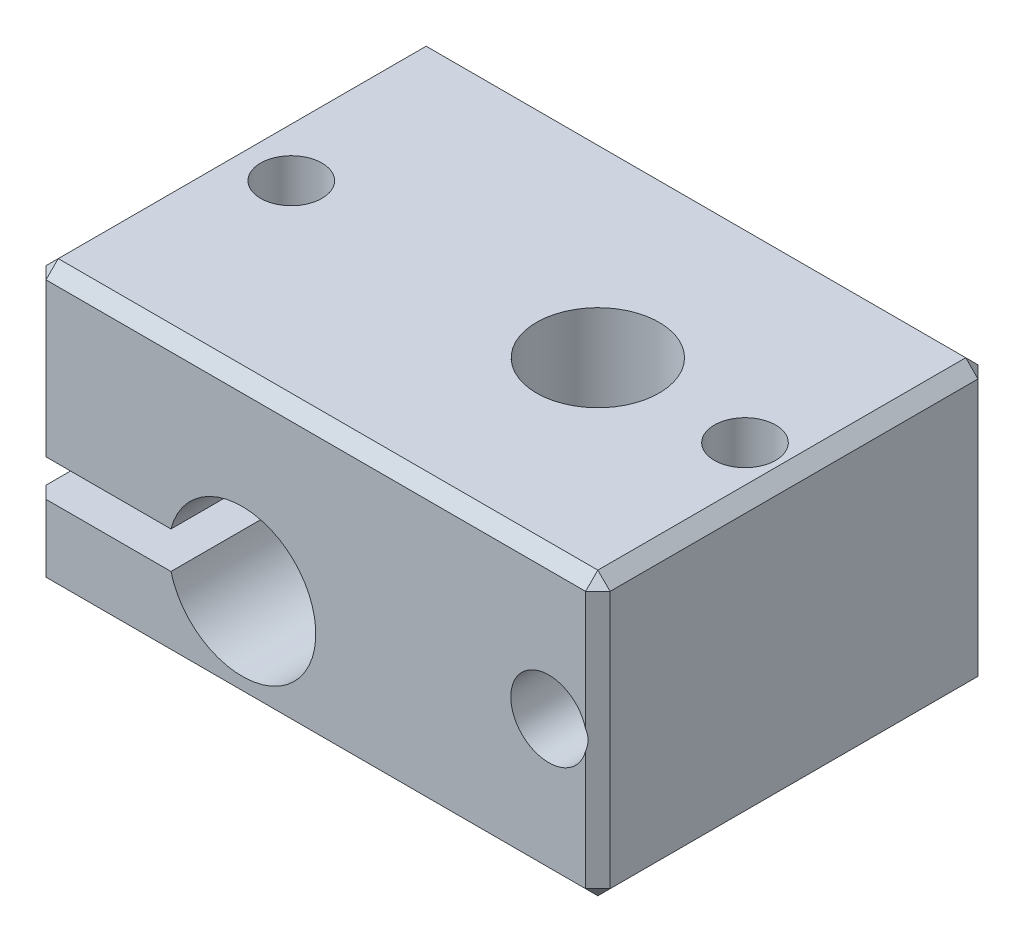
from build123d import *

# Parameters (mm, degrees)
SKETCH1_W                  = 23
SKETCH1_H                  = 16
BOSS_EXTRUDE1_DEPTH        = 11.5
SKETCH10_R                 = 1.55
CUT_EXTRUDE2_DEPTH         = 31.286135442
M3X0_5_TAPPED_HOLE1_REACH  = 32.286
M3X0_5_TAPPED_HOLE1_BORE_R = 1.25
M6_TAPPED_HOLE1_D          = 5
CUT_EXTRUDE1_DEPTH         = 16


with BuildPart() as part:
    # Sketch1 → Boss-Extrude1 (new body)
    with BuildSketch(Plane(origin=(0, 0, 0), x_dir=(1, 0, 0), z_dir=(0, 1, 0))):
        with Locations((11.5, 8)):
            Rectangle(SKETCH1_W, SKETCH1_H)
    extrude(amount=BOSS_EXTRUDE1_DEPTH)

    # Sketch10 → Cut-Extrude2 (cut, through all)
    with BuildSketch(Plane.XY):
        with Locations((21, 5.75)):
            Circle(SKETCH10_R)
    extrude(amount=-CUT_EXTRUDE2_DEPTH, mode=Mode.SUBTRACT)

    # M3x0.5 Tapped Hole1 bore → M3x0.5 Tapped Hole1 (cut, up to next)
    with BuildSketch(Plane(origin=(0, 11.5, 0), x_dir=(1, 0, 0), z_dir=(0, 1, 0)), mode=Mode.PRIVATE) as m3x0_5_tapped_hole1_sk1:
        with Locations((2.5, 8)):
            Circle(M3X0_5_TAPPED_HOLE1_BORE_R)
    m3x0_5_tapped_hole1_tool1 = extrude(m3x0_5_tapped_hole1_sk1.sketch, amount=-M3X0_5_TAPPED_HOLE1_REACH, mode=Mode.PRIVATE) & part.part
    # M3x0.5 Tapped Hole1 bore → M3x0.5 Tapped Hole1 (cut, up to next)
    with BuildSketch(Plane(origin=(0, 11.5, 0), x_dir=(1, 0, 0), z_dir=(0, 1, 0)), mode=Mode.PRIVATE) as m3x0_5_tapped_hole1_sk2:
        with Locations((21, 8)):
            Circle(M3X0_5_TAPPED_HOLE1_BORE_R)
    m3x0_5_tapped_hole1_tool2 = extrude(m3x0_5_tapped_hole1_sk2.sketch, amount=-M3X0_5_TAPPED_HOLE1_REACH, mode=Mode.PRIVATE) & part.part
    add(m3x0_5_tapped_hole1_tool1.solids().sort_by_distance((2.5, 11.5, -8))[0], mode=Mode.SUBTRACT)
    add(m3x0_5_tapped_hole1_tool2.solids().sort_by_distance((21, 11.5, -8))[0], mode=Mode.SUBTRACT)

    # M6 Tapped Hole1 (through all)
    with Locations(Plane(origin=(0, 11.5, 0), x_dir=(1, 0, 0), z_dir=(0, 1, 0))):
        with Locations((15, 8)):
            Hole(M6_TAPPED_HOLE1_D / 2)

    # Sketch2 → Cut-Extrude1 (cut)
    with BuildSketch(Plane.XY):
        with BuildLine():
            Line((5.59526249, 4.75), (0, 4.75))
            Line((0, 4.75), (0, 3.25))
            Line((0, 3.25), (5.59526249, 3.25))
            ThreePointArc((5.59526249, 3.25), (5.5, 4), (5.59526249, 4.75))
        make_face()
        with BuildLine():
            ThreePointArc((11.5, 4), (8.878012877, 6.976089089), (5.59526249, 4.75))
            Line((5.59526249, 4.75), (5.59526249, 3.25))
            ThreePointArc((5.59526249, 3.25), (8.878012877, 1.023910911), (11.5, 4))
        make_face()
        with BuildLine():
            Line((5.59526249, 3.25), (5.59526249, 4.75))
            ThreePointArc((5.59526249, 4.75), (5.5, 4), (5.59526249, 3.25))
        make_face()
    extrude(amount=-CUT_EXTRUDE1_DEPTH, mode=Mode.SUBTRACT)

    # Chamfer1
    # the kernel refuses this chamfer: 0.5 mm, written as the material it takes off along each edge
    with BuildSketch(Plane(origin=(22.666666667, 11.166666667, -0.333333333), x_dir=(0.7071067811865475, 0, -0.7071067811865475), z_dir=(0.5773502691896258, 0.5773502691896258, 0.5773502691896258)), Plane(origin=(0.333333333, 0.333333333, -0.333333333), x_dir=(-0.7071067811865475, 0, -0.7071067811865475), z_dir=(-0.5773502691896257, -0.5773502691896257, 0.5773502691896257)), Plane(origin=(0.333333333, 11.166666667, -0.333333333), x_dir=(0, 0.7071067811865476, -0.7071067811865475), z_dir=(-0.5773502691896258, 0.5773502691896257, 0.5773502691896258)), Plane(origin=(22.666666667, 0.333333333, -15.666666667), x_dir=(0, 0.7071067811865475, -0.7071067811865475), z_dir=(0.5773502691896258, -0.5773502691896258, -0.5773502691896258)), Plane(origin=(22.666666667, 0.333333333, -0.333333333), x_dir=(0, -0.7071067811865475, -0.7071067811865475), z_dir=(0.5773502691896258, -0.5773502691896258, 0.5773502691896258))) as chamfer1_piece_1:
        Polygon((-0.353553391, -0.204124145), (0.353553391, -0.204124145), (0, 0.40824829), align=None)
    extrude(amount=0.635085296, mode=Mode.SUBTRACT)
    with BuildSketch(Plane(origin=(22.666666667, 11.166666667, -15.666666667), x_dir=(0.7071067811865475, 0, 0.7071067811865475), z_dir=(0.5773502691896258, 0.5773502691896258, -0.5773502691896258)), Plane(origin=(0.333333333, 11.166666667, -15.666666667), x_dir=(0, 0.7071067811865475, 0.7071067811865475), z_dir=(-0.5773502691896258, 0.5773502691896257, -0.5773502691896258)), Plane(origin=(0.333333333, 0.333333333, -15.666666667), x_dir=(0.7071067811865475, -0.7071067811865475, 0), z_dir=(-0.5773502691896257, -0.5773502691896257, -0.5773502691896258))) as chamfer1_piece_2:
        Polygon((-0.353553391, 0.204124145), (0.353553391, 0.204124145), (0, -0.40824829), align=None)
    extrude(amount=0.635085296, mode=Mode.SUBTRACT)
    with BuildSketch(Plane(origin=(23, 11.5, 1.285841494), x_dir=(0.0274958766105891, -0.9996219169112968, 0), z_dir=(0, 0, -1)), Plane(origin=(23, 0, 1.285841494), x_dir=(-0.9996219169112968, -0.027495876610586292, 0), z_dir=(0, 0, -1)), Plane(origin=(0, 0, -17.285841494), x_dir=(0.9996219169112968, -0.027495876610586372, 0), z_dir=(0, 0, 1))) as chamfer1_piece_3:
        with BuildLine():
            Line((0.514336598, 0), (-0.028273577, 0.513558897))
            Line((-0.028273577, 0.513558897), (-0.038269797, 0.513283938))
            ThreePointArc((-0.038269797, 0.513283938), (-0.017064614, 0.256698915), (-0.009996219, -0.000274959))
            Line((-0.009996219, -0.000274959), (0.000274959, -0.009996219))
            ThreePointArc((0.000274959, -0.009996219), (0.257248832, -0.002927825), (0.514611556, -0.009996219))
            Line((0.514611556, -0.009996219), (0.514336598, 0))
        make_face()
    extrude(amount=18.571682988, mode=Mode.SUBTRACT)
    with BuildSketch(Plane(origin=(24.285841494, 11.5, -16), x_dir=(0, 0.027495876610585647, 0.9996219169112968), z_dir=(-1, 0, 0)), Plane(origin=(-1.285841494, 0, 0), x_dir=(0, 0.9996219169112968, 0.027495876610586372), z_dir=(1, 0, 0))) as chamfer1_piece_4:
        with BuildLine():
            Line((0.514336598, 0), (-0.028273577, -0.513558897))
            Line((-0.028273577, -0.513558897), (-0.038269797, -0.513283938))
            ThreePointArc((-0.038269797, -0.513283938), (-0.017064614, -0.256698915), (-0.009996219, 0.000274959))
            Line((-0.009996219, 0.000274959), (0.000274959, 0.009996219))
            ThreePointArc((0.000274959, 0.009996219), (0.257248832, 0.002927825), (0.514611556, 0.009996219))
            Line((0.514611556, 0.009996219), (0.514336598, 0))
        make_face()
    extrude(amount=25.571682988, mode=Mode.SUBTRACT)
    with BuildSketch(Plane(origin=(0, -1.285841494, -16), x_dir=(-0.02749587661058639, 0, 0.9996219169112968), z_dir=(0, 1, 0)), Plane(origin=(0, -1.285841494, 0), x_dir=(0.9996219169112968, 0, 0.027495876610586372), z_dir=(0, 1, 0))) as chamfer1_piece_5:
        with BuildLine():
            Line((0.514336598, 0), (-0.028273577, 0.513558897))
            Line((-0.028273577, 0.513558897), (-0.038269797, 0.513283938))
            ThreePointArc((-0.038269797, 0.513283938), (-0.017064614, 0.256698915), (-0.009996219, -0.000274959))
            Line((-0.009996219, -0.000274959), (0.000274959, -0.009996219))
            ThreePointArc((0.000274959, -0.009996219), (0.257248832, -0.002927825), (0.514611556, -0.009996219))
            Line((0.514611556, -0.009996219), (0.514336598, 0))
        make_face()
    extrude(amount=5.821682988, mode=Mode.SUBTRACT)
    with BuildSketch(Plane(origin=(0, 11.5, -17.285841494), x_dir=(0.9996219169112968, 0.02749587661058563, 0), z_dir=(0, 0, 1))) as chamfer1_piece_6:
        with BuildLine():
            Line((0.514336598, 0), (-0.028273577, -0.513558897))
            Line((-0.028273577, -0.513558897), (-0.038269797, -0.513283938))
            ThreePointArc((-0.038269797, -0.513283938), (-0.017064614, -0.256698915), (-0.009996219, 0.000274959))
            Line((-0.009996219, 0.000274959), (0.000274959, 0.009996219))
            ThreePointArc((0.000274959, 0.009996219), (0.257248832, 0.002927825), (0.514611556, 0.009996219))
            Line((0.514611556, 0.009996219), (0.514336598, 0))
        make_face()
    extrude(amount=18.571682988, mode=Mode.SUBTRACT)
    with BuildSketch(Plane(origin=(24.285841494, 0, -16), x_dir=(0, -0.02749587661058639, 0.9996219169112968), z_dir=(-1, 0, 0)), Plane(origin=(-1.285841494, 11.5, 0), x_dir=(0, -0.9996219169112968, 0.02749587661058639), z_dir=(1, 0, 0))) as chamfer1_piece_7:
        with BuildLine():
            Line((0.514336598, 0), (-0.028273577, 0.513558897))
            Line((-0.028273577, 0.513558897), (-0.038269797, 0.513283938))
            ThreePointArc((-0.038269797, 0.513283938), (-0.017064614, 0.256698915), (-0.009996219, -0.000274959))
            Line((-0.009996219, -0.000274959), (0.000274959, -0.009996219))
            ThreePointArc((0.000274959, -0.009996219), (0.257248832, -0.002927825), (0.514611556, -0.009996219))
            Line((0.514611556, -0.009996219), (0.514336598, 0))
        make_face()
    extrude(amount=25.571682988, mode=Mode.SUBTRACT)
    with BuildSketch(Plane(origin=(0, 3.464158506, -16), x_dir=(-0.02749587661058639, 0, 0.9996219169112968), z_dir=(0, 1, 0)), Plane(origin=(0, 3.464158506, 0), x_dir=(0.9996219169112968, 0, 0.027495876610586372), z_dir=(0, 1, 0))) as chamfer1_piece_8:
        with BuildLine():
            Line((0.514336598, 0), (-0.028273577, 0.513558897))
            Line((-0.028273577, 0.513558897), (-0.038269797, 0.513283938))
            ThreePointArc((-0.038269797, 0.513283938), (-0.017064614, 0.256698915), (-0.009996219, -0.000274959))
            Line((-0.009996219, -0.000274959), (0.000274959, -0.009996219))
            ThreePointArc((0.000274959, -0.009996219), (0.257248832, -0.002927825), (0.514611556, -0.009996219))
            Line((0.514611556, -0.009996219), (0.514336598, 0))
        make_face()
    extrude(amount=9.321682988, mode=Mode.SUBTRACT)
    with BuildSketch(Plane(origin=(23, -1.285841494, -16), x_dir=(0.0274958766105891, 0, 0.9996219169112968), z_dir=(0, 1, 0)), Plane(origin=(23, -1.285841494, 0), x_dir=(-0.9996219169112968, 0, 0.027495876610586292), z_dir=(0, 1, 0))) as chamfer1_piece_9:
        with BuildLine():
            Line((0.514336598, 0), (-0.028273577, -0.513558897))
            Line((-0.028273577, -0.513558897), (-0.038269797, -0.513283938))
            ThreePointArc((-0.038269797, -0.513283938), (-0.017064614, -0.256698915), (-0.009996219, 0.000274959))
            Line((-0.009996219, 0.000274959), (0.000274959, 0.009996219))
            ThreePointArc((0.000274959, 0.009996219), (0.257248832, 0.002927825), (0.514611556, 0.009996219))
            Line((0.514611556, 0.009996219), (0.514336598, 0))
        make_face()
    extrude(amount=14.071682988, mode=Mode.SUBTRACT)


solid = part.part
